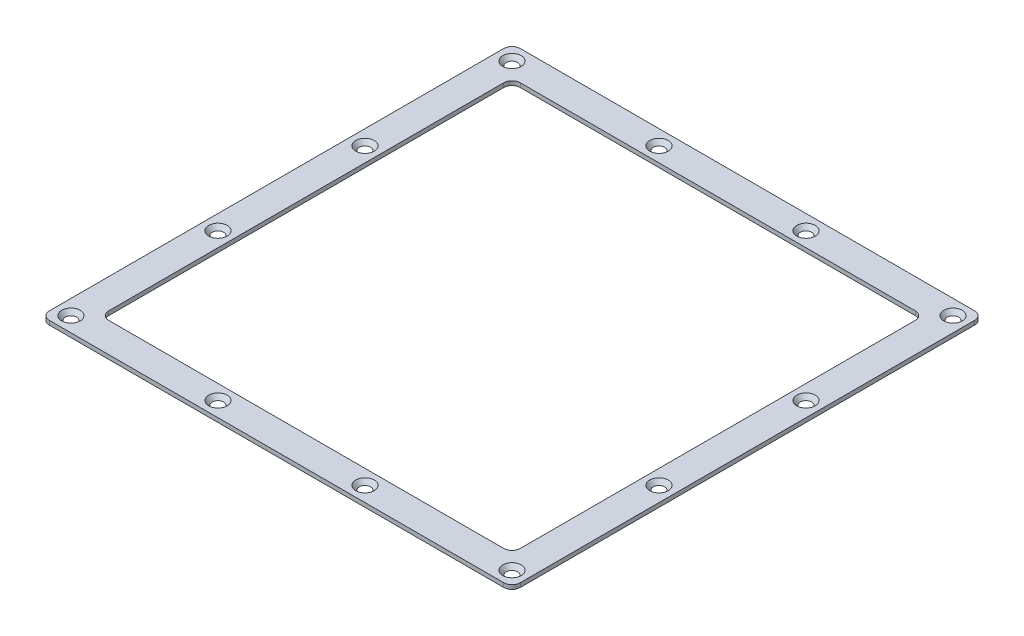
from build123d import *

# Parameters (mm, degrees)
BASE_FLANGE1_DEPTH                            = 1.5875
CUT_EXTRUDE1_DEPTH                            = 255.864612872
CSK_FOR_6_FLAT_HEAD_MACHINE_SCREW1_AT_2_COUNT = 2
CSK_FOR_6_FLAT_HEAD_MACHINE_SCREW1_AT_2_PITCH = 56.261
CSK_FOR_6_FLAT_HEAD_MACHINE_SCREW1_AT_3_COUNT = 2
CSK_FOR_6_FLAT_HEAD_MACHINE_SCREW1_AT_3_PITCH = 177.912903439
CSK_FOR_6_FLAT_HEAD_MACHINE_SCREW1_AT_4_COUNT = 2
CSK_FOR_6_FLAT_HEAD_MACHINE_SCREW1_AT_4_PITCH = 168.783
CSK_FOR_6_FLAT_HEAD_MACHINE_SCREW1_AT_5_COUNT = 2
CSK_FOR_6_FLAT_HEAD_MACHINE_SCREW1_AT_5_PITCH = 112.522
CSK_FOR_6_FLAT_HEAD_MACHINE_SCREW1_AT_6_COUNT = 2
CSK_FOR_6_FLAT_HEAD_MACHINE_SCREW1_AT_6_PITCH = 56.261
CSK_FOR_6_FLAT_HEAD_MACHINE_SCREW1_AT_7_COUNT = 2
CSK_FOR_6_FLAT_HEAD_MACHINE_SCREW1_AT_7_PITCH = 112.522
CSK_FOR_6_FLAT_HEAD_MACHINE_SCREW1_AT_8_COUNT = 2
CSK_FOR_6_FLAT_HEAD_MACHINE_SCREW1_AT_8_PITCH = 168.783
CSK_FOR_6_FLAT_HEAD_MACHINE_SCREW1_AT_9_COUNT = 2
CSK_FOR_6_FLAT_HEAD_MACHINE_SCREW1_AT_9_PITCH = 177.912903439
CSK_FOR_6_FLAT_HEAD_MACHINE_SCREW1_AT_1_COUNT = 2
CSK_FOR_6_FLAT_HEAD_MACHINE_SCREW1_AT_1_PITCH = 202.851920309
CSK_FOR_6_FLAT_HEAD_MACHINE_SCREW1_2_COUNT    = 2
CSK_FOR_6_FLAT_HEAD_MACHINE_SCREW1_2_PITCH    = 202.851920309
CSK_FOR_6_FLAT_HEAD_MACHINE_SCREW1_3_COUNT    = 2
CSK_FOR_6_FLAT_HEAD_MACHINE_SCREW1_3_PITCH    = 238.695207698


# Sheet-metal steps are written as plain solids
with BuildPart() as part:
    # Sketch2 → Base-Flange1 (new body)
    with BuildSketch(Plane(origin=(0, 0, 0), x_dir=(1, 0, 0), z_dir=(0, 1, 0))):
        with BuildLine():
            Line((3.175, 0), (177.038, 0))
            ThreePointArc((177.038, 0), (179.28306403, 0.92993597), (180.213, 3.175))
            Line((180.213, 3.175), (180.213, 177.038))
            ThreePointArc((180.213, 177.038), (179.28306403, 179.28306403), (177.038, 180.213))
            Line((177.038, 180.213), (3.175, 180.213))
            ThreePointArc((3.175, 180.213), (0.92993597, 179.28306403), (0, 177.038))
            Line((0, 177.038), (0, 3.175))
            ThreePointArc((0, 3.175), (0.92993597, 0.92993597), (3.175, 0))
        make_face()
    extrude(amount=-BASE_FLANGE1_DEPTH)

    # Sketch7 → Cut-Extrude1 (cut, through all)
    with BuildSketch(Plane(origin=(0, 0, 0), x_dir=(1, 0, 0), z_dir=(0, 1, 0))):
        with BuildLine():
            Line((14.5288, 168.8592), (165.6842, 168.8592))
            ThreePointArc((165.6842, 168.8592), (167.92926403, 167.92926403), (168.8592, 165.6842))
            Line((168.8592, 165.6842), (168.8592, 14.5288))
            ThreePointArc((168.8592, 14.5288), (167.92926403, 12.28373597), (165.6842, 11.3538))
            Line((165.6842, 11.3538), (14.5288, 11.3538))
            ThreePointArc((14.5288, 11.3538), (12.28373597, 12.28373597), (11.3538, 14.5288))
            Line((11.3538, 14.5288), (11.3538, 165.6842))
            ThreePointArc((11.3538, 165.6842), (12.28373597, 167.92926403), (14.5288, 168.8592))
        make_face()
    extrude(amount=-CUT_EXTRUDE1_DEPTH, mode=Mode.SUBTRACT)

    # Sketch8 → CSK for #6 Flat Head Machine Screw1 (revolve, cut)
    with BuildSketch(Plane(origin=(5.715, 0, -174.4979492), x_dir=(0, 0, 1), z_dir=(1, 0, 0))):
        Polygon((0, 0), (0, 1.5875), (1.8288, 1.5875), (1.8288, 1.972306634), (3.5433, 0), align=None)
    csk_for_6_flat_head_machine_screw1 = revolve(axis=Axis((5.715, 6.35, -174.4979492), (0, -1, 0)), mode=Mode.SUBTRACT)

    # CSK for #6 Flat Head Machine Screw1 at 2: CSK for #6 Flat Head Machine Screw1 ×2
    with Locations(*[(i * CSK_FOR_6_FLAT_HEAD_MACHINE_SCREW1_AT_2_PITCH, 0, 0) for i in range(1, CSK_FOR_6_FLAT_HEAD_MACHINE_SCREW1_AT_2_COUNT)]):
        add(csk_for_6_flat_head_machine_screw1, mode=Mode.SUBTRACT)

    # CSK for #6 Flat Head Machine Screw1 at 3: CSK for #6 Flat Head Machine Screw1 ×2
    with Locations(*[Vector(0.3162277660168381, 0, 0.9486832980505138) * (i * CSK_FOR_6_FLAT_HEAD_MACHINE_SCREW1_AT_3_PITCH) for i in range(1, CSK_FOR_6_FLAT_HEAD_MACHINE_SCREW1_AT_3_COUNT)]):
        add(csk_for_6_flat_head_machine_screw1, mode=Mode.SUBTRACT)

    # CSK for #6 Flat Head Machine Screw1 at 4: CSK for #6 Flat Head Machine Screw1 ×2
    with Locations(*[(0, 0, i * CSK_FOR_6_FLAT_HEAD_MACHINE_SCREW1_AT_4_PITCH) for i in range(1, CSK_FOR_6_FLAT_HEAD_MACHINE_SCREW1_AT_4_COUNT)]):
        add(csk_for_6_flat_head_machine_screw1, mode=Mode.SUBTRACT)

    # CSK for #6 Flat Head Machine Screw1 at 5: CSK for #6 Flat Head Machine Screw1 ×2
    with Locations(*[(0, 0, i * CSK_FOR_6_FLAT_HEAD_MACHINE_SCREW1_AT_5_PITCH) for i in range(1, CSK_FOR_6_FLAT_HEAD_MACHINE_SCREW1_AT_5_COUNT)]):
        add(csk_for_6_flat_head_machine_screw1, mode=Mode.SUBTRACT)

    # CSK for #6 Flat Head Machine Screw1 at 6: CSK for #6 Flat Head Machine Screw1 ×2
    with Locations(*[(0, 0, i * CSK_FOR_6_FLAT_HEAD_MACHINE_SCREW1_AT_6_PITCH) for i in range(1, CSK_FOR_6_FLAT_HEAD_MACHINE_SCREW1_AT_6_COUNT)]):
        add(csk_for_6_flat_head_machine_screw1, mode=Mode.SUBTRACT)

    # CSK for #6 Flat Head Machine Screw1 at 7: CSK for #6 Flat Head Machine Screw1 ×2
    with Locations(*[(i * CSK_FOR_6_FLAT_HEAD_MACHINE_SCREW1_AT_7_PITCH, 0, 0) for i in range(1, CSK_FOR_6_FLAT_HEAD_MACHINE_SCREW1_AT_7_COUNT)]):
        add(csk_for_6_flat_head_machine_screw1, mode=Mode.SUBTRACT)

    # CSK for #6 Flat Head Machine Screw1 at 8: CSK for #6 Flat Head Machine Screw1 ×2
    with Locations(*[(i * CSK_FOR_6_FLAT_HEAD_MACHINE_SCREW1_AT_8_PITCH, 0, 0) for i in range(1, CSK_FOR_6_FLAT_HEAD_MACHINE_SCREW1_AT_8_COUNT)]):
        add(csk_for_6_flat_head_machine_screw1, mode=Mode.SUBTRACT)

    # CSK for #6 Flat Head Machine Screw1 at 9: CSK for #6 Flat Head Machine Screw1 ×2
    with Locations(*[Vector(0.9486832980505139, 0, 0.31622776601683783) * (i * CSK_FOR_6_FLAT_HEAD_MACHINE_SCREW1_AT_9_PITCH) for i in range(1, CSK_FOR_6_FLAT_HEAD_MACHINE_SCREW1_AT_9_COUNT)]):
        add(csk_for_6_flat_head_machine_screw1, mode=Mode.SUBTRACT)

    # CSK for #6 Flat Head Machine Screw1 at 1: CSK for #6 Flat Head Machine Screw1 ×2
    with Locations(*[Vector(0.8320502943378437, 0, 0.5547001962252291) * (i * CSK_FOR_6_FLAT_HEAD_MACHINE_SCREW1_AT_1_PITCH) for i in range(1, CSK_FOR_6_FLAT_HEAD_MACHINE_SCREW1_AT_1_COUNT)]):
        add(csk_for_6_flat_head_machine_screw1, mode=Mode.SUBTRACT)

    # CSK for #6 Flat Head Machine Screw1  2: CSK for #6 Flat Head Machine Screw1 ×2
    with Locations(*[Vector(0.5547001962252293, 0, 0.8320502943378436) * (i * CSK_FOR_6_FLAT_HEAD_MACHINE_SCREW1_2_PITCH) for i in range(1, CSK_FOR_6_FLAT_HEAD_MACHINE_SCREW1_2_COUNT)]):
        add(csk_for_6_flat_head_machine_screw1, mode=Mode.SUBTRACT)

    # CSK for #6 Flat Head Machine Screw1  3: CSK for #6 Flat Head Machine Screw1 ×2
    with Locations(*[Vector(0.7071067811865477, 0, 0.7071067811865475) * (i * CSK_FOR_6_FLAT_HEAD_MACHINE_SCREW1_3_PITCH) for i in range(1, CSK_FOR_6_FLAT_HEAD_MACHINE_SCREW1_3_COUNT)]):
        add(csk_for_6_flat_head_machine_screw1, mode=Mode.SUBTRACT)


solid = part.part
